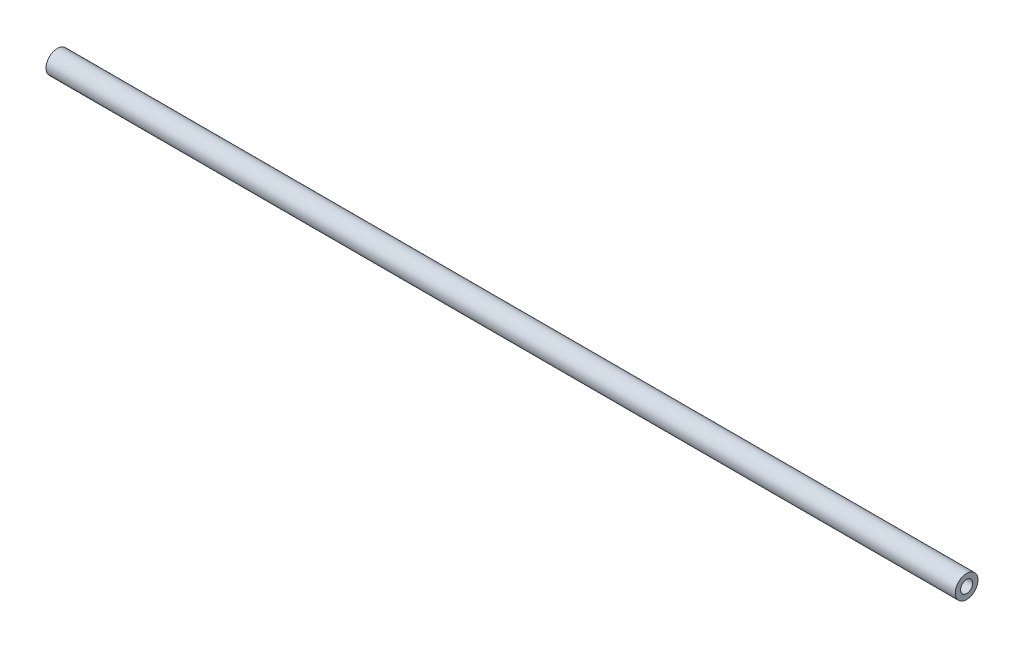
from build123d import *

# Parameters (mm, degrees)
SKETCH1_R                   = 4.7625
BOSS_EXTRUDE1_DEPTH         = 381
F_1_4_20_TAPPED_HOLE1_D     = 5.1054
F_1_4_20_TAPPED_HOLE1_DEPTH = 16.51
F_1_4_20_TAPPED_HOLE1_TIP   = 1.533816902
F_1_4_20_TAPPED_HOLE2_D     = 5.1054
F_1_4_20_TAPPED_HOLE2_DEPTH = 16.51
F_1_4_20_TAPPED_HOLE2_TIP   = 1.533816902


with BuildPart() as part:
    # Sketch1 → Boss-Extrude1 (new body)
    with BuildSketch(Plane(origin=(0, 0, 0), x_dir=(0, 0, -1), z_dir=(1, 0, 0))):
        Circle(SKETCH1_R)
    extrude(amount=BOSS_EXTRUDE1_DEPTH)

    # 1/4-20 Tapped Hole1
    with Locations(Plane.ZY):
        with Locations((0, 0)):
            Hole(F_1_4_20_TAPPED_HOLE1_D / 2, depth=F_1_4_20_TAPPED_HOLE1_DEPTH)
            with Locations((0, 0, -(F_1_4_20_TAPPED_HOLE1_DEPTH + F_1_4_20_TAPPED_HOLE1_TIP / 2))):  # 118° drill point
                Cone(0, F_1_4_20_TAPPED_HOLE1_D / 2, F_1_4_20_TAPPED_HOLE1_TIP, mode=Mode.SUBTRACT)

    # 1/4-20 Tapped Hole2
    with Locations(Plane(origin=(381, 0, 0), x_dir=(0, 0, -1), z_dir=(1, 0, 0))):
        with Locations((0, 0)):
            Hole(F_1_4_20_TAPPED_HOLE2_D / 2, depth=F_1_4_20_TAPPED_HOLE2_DEPTH)
            with Locations((0, 0, -(F_1_4_20_TAPPED_HOLE2_DEPTH + F_1_4_20_TAPPED_HOLE2_TIP / 2))):  # 118° drill point
                Cone(0, F_1_4_20_TAPPED_HOLE2_D / 2, F_1_4_20_TAPPED_HOLE2_TIP, mode=Mode.SUBTRACT)


solid = part.part
